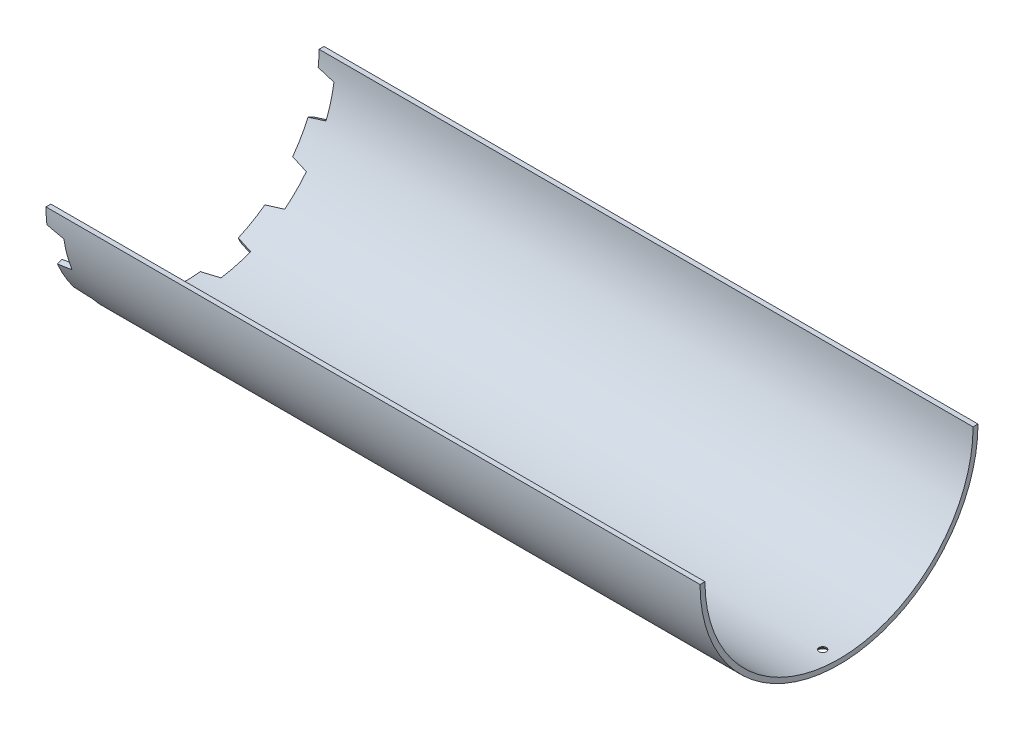
from build123d import *
from build123d.topology import SkipClean

# Parameters (mm, degrees)
SKETCH1_W                      = 390
SKETCH1_H                      = 3
BOSS_EXTRUDE1_DEPTH            = 5
DRAFT1_ANGLE                   = -15
CIRPATTERN1_COUNT              = 12
DRAFT1_OF_CIRPATTERN1_2_ANGLE  = -15
DRAFT1_OF_CIRPATTERN1_3_ANGLE  = -15
DRAFT1_OF_CIRPATTERN1_4_ANGLE  = -15
DRAFT1_OF_CIRPATTERN1_5_ANGLE  = -15
DRAFT1_OF_CIRPATTERN1_6_ANGLE  = -15
DRAFT1_OF_CIRPATTERN1_7_ANGLE  = -15
DRAFT1_OF_CIRPATTERN1_8_ANGLE  = -15
DRAFT1_OF_CIRPATTERN1_9_ANGLE  = -15
DRAFT1_OF_CIRPATTERN1_10_ANGLE = -15
DRAFT1_OF_CIRPATTERN1_11_ANGLE = -15
DRAFT1_OF_CIRPATTERN1_12_ANGLE = -15
CUT_EXTRUDE1_DEPTH             = 563.983125857


# Read off the part's stored shape, not the designer's step: CSK for M4 Countersunk Flat Head Screw1
with BuildPart() as part:
    # Sketch1 → Revolve1 (revolve)
    with BuildSketch(Plane.XY, mode=Mode.PRIVATE) as revolve1_sk:
        with Locations((355, 83.5)):
            Rectangle(SKETCH1_W, SKETCH1_H)
    revolve(revolve1_sk.sketch.rotate(Axis((0, 0, 0), (1, 0, 0)), 90), axis=Axis((0, 0, 0), (1, 0, 0)))

    # Sketch2 → Boss-Extrude1 (add, symmetric)
    with BuildSketch(Plane(origin=(155, 0, 0), x_dir=(0, 0, -1), z_dir=(1, 0, 0))):
        with BuildLine():
            Line((10.703147762, 81.298478633), (11.094726339, 84.272813217))
            ThreePointArc((11.094726339, 84.272813217), (0, 85), (-11.094726339, 84.272813217))
            Line((-11.094726339, 84.272813217), (-10.703147762, 81.298478633))
            ThreePointArc((-10.703147762, 81.298478633), (0, 82), (10.703147762, 81.298478633))
        make_face()
    boss_extrude1 = extrude(amount=BOSS_EXTRUDE1_DEPTH, both=True)

    # Draft1
    draft1_faces = [part.faces().sort_by_distance(p)[0] for p in [
        (155, 82.785645925, 10.89893705),
        (155, 82.785645925, -10.89893705),
    ]]
    draft(draft1_faces, Plane(origin=(155, 0, 0), x_dir=(0, 0, 1), z_dir=(1, 0, 0)), DRAFT1_ANGLE)

    # CirPattern1: Boss-Extrude1 ×12 about axis
    with SkipClean():  # the faces are left unmerged after this step: merging them gives an invalid solid
        cirpattern1_axis = Axis((0, 0, 0), (1, 0, 0))
        for i in range(1, CIRPATTERN1_COUNT):
            add(boss_extrude1.rotate(cirpattern1_axis, i * 360 / CIRPATTERN1_COUNT))

    # Draft1 of CirPattern1 2
    draft1_of_cirpattern1_2_faces = [part.faces().sort_by_distance(p)[0] for p in [
        (155, 66.245003914, 50.831579322),
        (155, 77.143940965, 31.954066602),
    ]]
    draft(draft1_of_cirpattern1_2_faces, Plane(origin=(155, 0, 0), x_dir=(0, -0.49999999999999994, 0.8660254037844387), z_dir=(1, 0, 0)), DRAFT1_OF_CIRPATTERN1_2_ANGLE)

    # Draft1 of CirPattern1 3
    draft1_of_cirpattern1_3_faces = [part.faces().sort_by_distance(p)[0] for p in [
        (155, 31.954066602, 77.143940965),
        (155, 50.831579322, 66.245003914),
    ]]
    draft(draft1_of_cirpattern1_3_faces, Plane(origin=(155, 0, 0), x_dir=(0, -0.8660254037844386, 0.5000000000000001), z_dir=(1, 0, 0)), DRAFT1_OF_CIRPATTERN1_3_ANGLE)

    # Draft1 of CirPattern1 4
    draft1_of_cirpattern1_4_faces = [part.faces().sort_by_distance(p)[0] for p in [
        (155, -10.89893705, 82.785645925),
        (155, 10.89893705, 82.785645925),
    ]]
    draft(draft1_of_cirpattern1_4_faces, Plane(origin=(155, 0, 0), x_dir=(0, -1, 0), z_dir=(1, 0, 0)), DRAFT1_OF_CIRPATTERN1_4_ANGLE)

    # Draft1 of CirPattern1 5
    draft1_of_cirpattern1_5_faces = [part.faces().sort_by_distance(p)[0] for p in [
        (155, -50.831579322, 66.245003914),
        (155, -31.954066602, 77.143940965),
    ]]
    draft(draft1_of_cirpattern1_5_faces, Plane(origin=(155, 0, 0), x_dir=(0, -0.8660254037844387, -0.4999999999999998), z_dir=(1, 0, 0)), DRAFT1_OF_CIRPATTERN1_5_ANGLE)

    # Draft1 of CirPattern1 6
    draft1_of_cirpattern1_6_faces = [part.faces().sort_by_distance(p)[0] for p in [
        (155, -77.143940965, 31.954066602),
        (155, -66.245003914, 50.831579322),
    ]]
    draft(draft1_of_cirpattern1_6_faces, Plane(origin=(155, 0, 0), x_dir=(0, -0.49999999999999994, -0.8660254037844387), z_dir=(1, 0, 0)), DRAFT1_OF_CIRPATTERN1_6_ANGLE)

    # Draft1 of CirPattern1 7
    draft1_of_cirpattern1_7_faces = [part.faces().sort_by_distance(p)[0] for p in [
        (155, -82.785645925, -10.89893705),
        (155, -82.785645925, 10.89893705),
    ]]
    draft(draft1_of_cirpattern1_7_faces, Plane(origin=(155, 0, 0), x_dir=(0, 0, -1), z_dir=(1, 0, 0)), DRAFT1_OF_CIRPATTERN1_7_ANGLE)

    # Draft1 of CirPattern1 8
    draft1_of_cirpattern1_8_faces = [part.faces().sort_by_distance(p)[0] for p in [
        (155, -66.245003914, -50.831579322),
        (155, -77.143940965, -31.954066602),
    ]]
    draft(draft1_of_cirpattern1_8_faces, Plane(origin=(155, 0, 0), x_dir=(0, 0.5000000000000001, -0.8660254037844386), z_dir=(1, 0, 0)), DRAFT1_OF_CIRPATTERN1_8_ANGLE)

    # Draft1 of CirPattern1 9
    draft1_of_cirpattern1_9_faces = [part.faces().sort_by_distance(p)[0] for p in [
        (155, -31.954066602, -77.143940965),
        (155, -50.831579322, -66.245003914),
    ]]
    draft(draft1_of_cirpattern1_9_faces, Plane(origin=(155, 0, 0), x_dir=(0, 0.8660254037844384, -0.5000000000000004), z_dir=(1, 0, 0)), DRAFT1_OF_CIRPATTERN1_9_ANGLE)

    # Draft1 of CirPattern1 10
    draft1_of_cirpattern1_10_faces = [part.faces().sort_by_distance(p)[0] for p in [
        (155, 10.89893705, -82.785645925),
        (155, -10.89893705, -82.785645925),
    ]]
    draft(draft1_of_cirpattern1_10_faces, Plane.YZ.offset(155), DRAFT1_OF_CIRPATTERN1_10_ANGLE)

    # Draft1 of CirPattern1 11
    draft1_of_cirpattern1_11_faces = [part.faces().sort_by_distance(p)[0] for p in [
        (155, 50.831579322, -66.245003914),
        (155, 31.954066602, -77.143940965),
    ]]
    draft(draft1_of_cirpattern1_11_faces, Plane(origin=(155, 0, 0), x_dir=(0, 0.8660254037844386, 0.5000000000000001), z_dir=(1, 0, 0)), DRAFT1_OF_CIRPATTERN1_11_ANGLE)

    # Draft1 of CirPattern1 12
    draft1_of_cirpattern1_12_faces = [part.faces().sort_by_distance(p)[0] for p in [
        (155, 77.143940965, -31.954066602),
        (155, 66.245003914, -50.831579322),
    ]]
    draft(draft1_of_cirpattern1_12_faces, Plane(origin=(155, 0, 0), x_dir=(0, 0.5000000000000004, 0.8660254037844384), z_dir=(1, 0, 0)), DRAFT1_OF_CIRPATTERN1_12_ANGLE)

    # Sketch3 → Cut-Extrude1 (cut, through all)
    with BuildSketch(Plane(origin=(0, 0, 0), x_dir=(0, 0, -1), z_dir=(1, 0, 0))):
        with BuildLine():
            Line((0, 0), (-85, 0))
            ThreePointArc((-85, 0), (0, 85), (85, 0))
            Line((85, 0), (0, 0))
        make_face()
    extrude(amount=CUT_EXTRUDE1_DEPTH, mode=Mode.SUBTRACT)

    # CSK for M4 Countersunk Flat Head Scr 2 → CSK for M4 Countersunk Flat Head Screw1 (revolve, cut)
    with BuildSketch(Plane(origin=(540, 0, 0), x_dir=(1, 0, 0), z_dir=(0, 0, 1))):
        Polygon((0, -85.000032153), (4.700032153, -85.000032153), (2.25, -82.55), (2.25, -81.96910869), (0, -81.96910869), align=None)
    revolve(axis=Axis((540, 0, 0), (0, 1, 0)), mode=Mode.SUBTRACT)


solid = part.part
